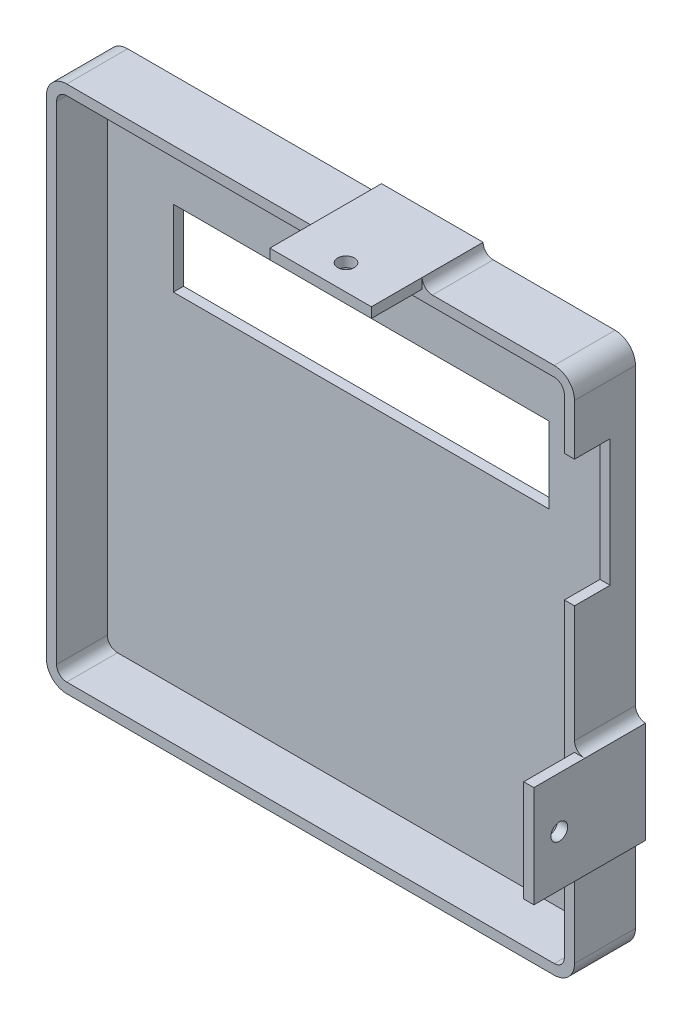
from build123d import *

# Parameters (mm, degrees)
EXTRUDE_2_DEPTH     = 2
EXTRUDE_3_DEPTH     = 10
SKETCH_5_W          = 7
SKETCH_5_H          = 25
CUT_EXTRUDE_1_DEPTH = 10
SKETCH_6_W          = 74
SKETCH_6_H          = 15
CUT_EXTRUDE_2_DEPTH = 10
SKETCH_7_W          = 20
SKETCH_7_H          = 2
SKETCH_7_W_2        = 2
SKETCH_7_H_2        = 20
EXTRUDE_4_DEPTH     = 22
SKETCH_8_R          = 1.65
CUT_EXTRUDE_3_DEPTH = 22
SKETCH_10_R         = 1.65
CUT_EXTRUDE_4_DEPTH = 22
FILLET_1_R          = 2


with BuildPart() as part:
    # 草图1 → 凸台-拉伸2 (new body)
    with BuildSketch(Plane.XY):
        with BuildLine():
            Line((4, 0), (100, 0))
            ThreePointArc((100, 0), (102.828427125, 1.171572875), (104, 4))
            Line((104, 4), (104, 100))
            ThreePointArc((104, 100), (102.828427125, 102.828427125), (100, 104))
            Line((100, 104), (4, 104))
            ThreePointArc((4, 104), (1.171572875, 102.828427125), (0, 100))
            Line((0, 100), (0, 4))
            ThreePointArc((0, 4), (1.171572875, 1.171572875), (4, 0))
        make_face()
    extrude(amount=EXTRUDE_2_DEPTH)

    # 草图4 → 凸台-拉伸3 (add)
    with BuildSketch(Plane.XY.offset(2)):
        with BuildLine():
            Line((104, 4), (104, 100))
            ThreePointArc((104, 100), (102.828427125, 102.828427125), (100, 104))
            Line((100, 104), (4, 104))
            ThreePointArc((4, 104), (1.171572875, 102.828427125), (0, 100))
            Line((0, 100), (0, 4))
            ThreePointArc((0, 4), (1.171572875, 1.171572875), (4, 0))
            Line((4, 0), (100, 0))
            ThreePointArc((100, 0), (102.828427125, 1.171572875), (104, 4))
        make_face()
        with BuildLine():
            Line((102, 4), (102, 100))
            ThreePointArc((102, 100), (101.414213562, 101.414213562), (100, 102))
            Line((100, 102), (4, 102))
            ThreePointArc((4, 102), (2.585786438, 101.414213562), (2, 100))
            Line((2, 100), (2, 4))
            ThreePointArc((2, 4), (2.585786438, 2.585786438), (4, 2))
            Line((4, 2), (100, 2))
            ThreePointArc((100, 2), (101.414213562, 2.585786438), (102, 4))
        make_face(mode=Mode.SUBTRACT)
    extrude(amount=EXTRUDE_3_DEPTH)

    # 草图5 → 切除-拉伸1 (cut)
    with BuildSketch(Plane(origin=(104, 0, 0), x_dir=(0, 0, -1), z_dir=(1, 0, 0))):
        with Locations((-8.5, 77.5)):
            Rectangle(SKETCH_5_W, SKETCH_5_H)
    extrude(amount=-CUT_EXTRUDE_1_DEPTH, mode=Mode.SUBTRACT)

    # 草图6 → 切除-拉伸2 (cut)
    with BuildSketch(Plane(origin=(0, 0, 0), x_dir=(-1, 0, 0), z_dir=(0, 0, -1))):
        with Locations((-52, 76.5)):
            Rectangle(SKETCH_6_W, SKETCH_6_H)
    extrude(amount=-CUT_EXTRUDE_2_DEPTH, mode=Mode.SUBTRACT)

    # 草图7 → 凸台-拉伸4 (add)
    with BuildSketch(Plane(origin=(0, 0, 0), x_dir=(-1, 0, 0), z_dir=(0, 0, -1))):
        with Locations((-64, 105)):
            Rectangle(SKETCH_7_W, SKETCH_7_H)
        with Locations((-105, 30)):
            Rectangle(SKETCH_7_W_2, SKETCH_7_H_2)
    extrude(amount=-EXTRUDE_4_DEPTH)

    # 草图8 → 切除-拉伸3 (cut)
    with BuildSketch(Plane(origin=(106, 0, 0), x_dir=(0, 0, -1), z_dir=(1, 0, 0))):
        with Locations((-17, 30)):
            Circle(SKETCH_8_R)
    extrude(amount=-CUT_EXTRUDE_3_DEPTH, mode=Mode.SUBTRACT)

    # 草图10 → 切除-拉伸4 (cut)
    with BuildSketch(Plane(origin=(0, 106, 0), x_dir=(1, 0, 0), z_dir=(0, 1, 0))):
        with Locations(Location((64, -17, 0), (0, 0, 270))):
            Circle(SKETCH_10_R)
    extrude(amount=-CUT_EXTRUDE_4_DEPTH, mode=Mode.SUBTRACT)

    # 圆角1
    fillet_1_edges = [part.edges().sort_by_distance(p)[0] for p in [
        (54, 104, 6),
        (74, 104, 6),
        (104, 40, 6),
        (104, 20, 6),
    ]]
    fillet(fillet_1_edges, radius=FILLET_1_R - 0.0001)  # a hair under: the kernel refuses the full size


solid = part.part
